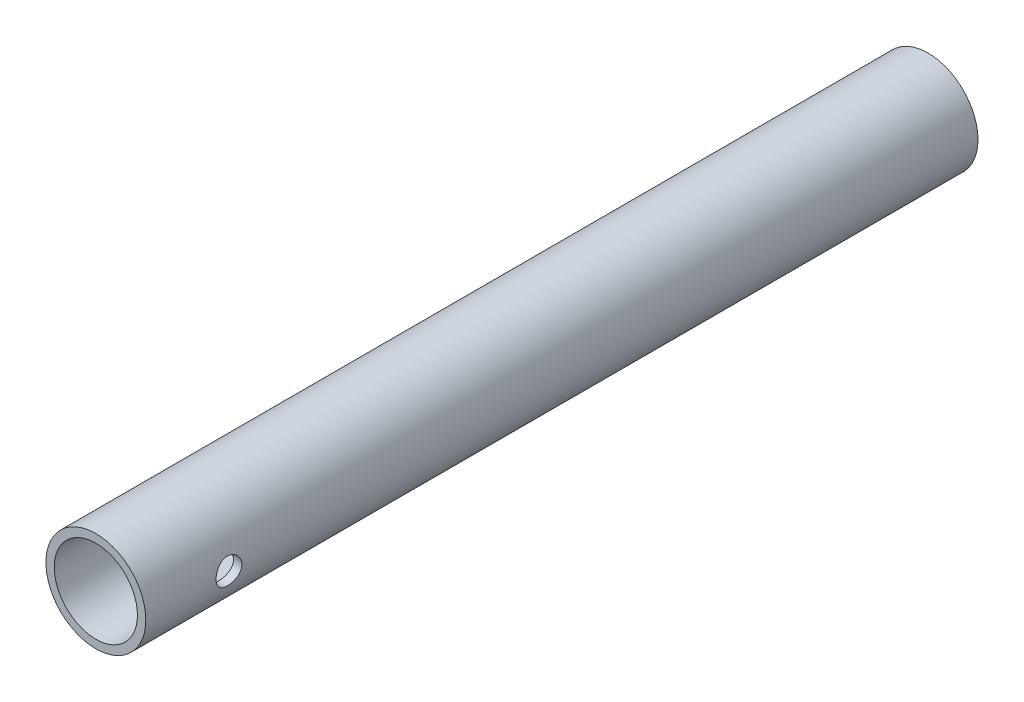
from build123d import *

# Parameters (mm, degrees)
SKETCH_1_R               = 6
SKETCH_1_R_2             = 5
EXTRUDE_1_DEPTH          = 100
CUT_EXTRUDE_1_DEPTH      = 101.359354322
CUT_EXTRUDE_1_DEPTH_BACK = 101.359354322
SKETCH_2_R               = 1.55


with BuildPart() as part:
    # 草图1 → 凸台-拉伸1 (new body)
    with BuildSketch(Plane.XY):
        Circle(SKETCH_1_R)
        Circle(SKETCH_1_R_2, mode=Mode.SUBTRACT)
    extrude(amount=EXTRUDE_1_DEPTH)

    # 草图2 → 切除-拉伸1 (cut, two sides: drawn at the far end of the back side and taken through both)
    with BuildSketch(Plane(origin=(0, 0, 0), x_dir=(0, 0, -1), z_dir=(1, 0, 0)).offset(-CUT_EXTRUDE_1_DEPTH_BACK)):
        with Locations((-90, 0)):
            Circle(SKETCH_2_R)
    extrude(amount=CUT_EXTRUDE_1_DEPTH + CUT_EXTRUDE_1_DEPTH_BACK, mode=Mode.SUBTRACT)


solid = part.part
